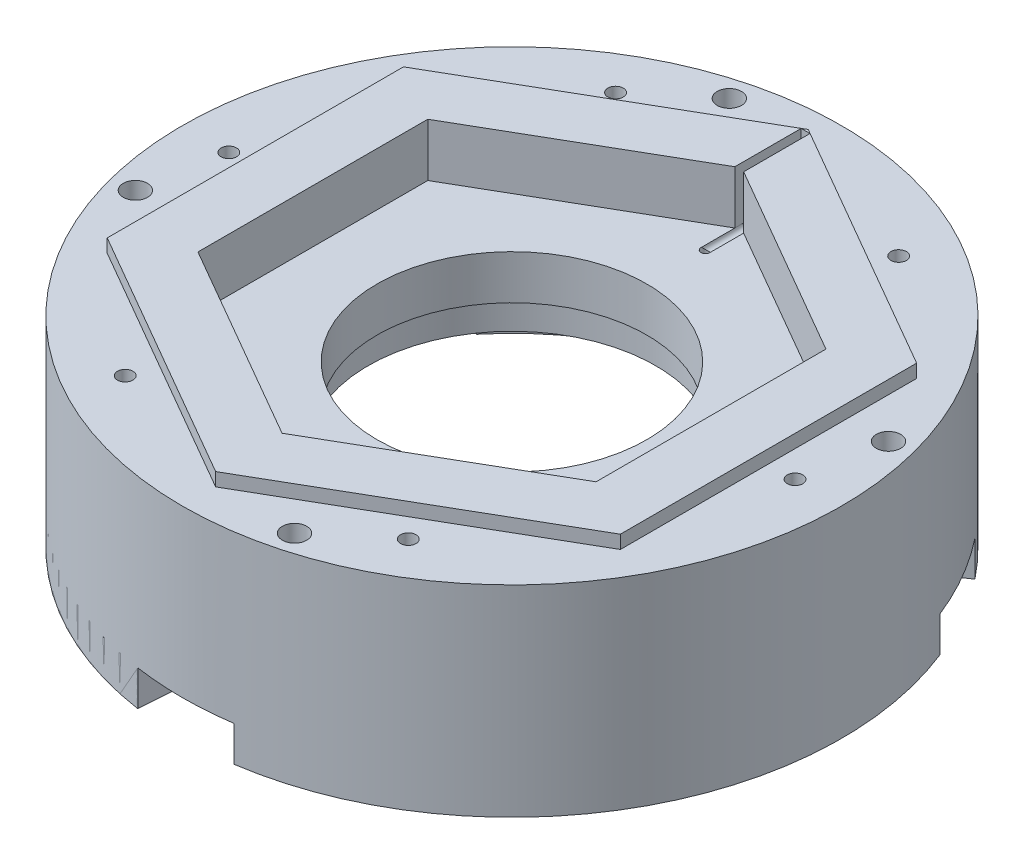
from build123d import *
from build123d.topology import SkipClean

# Parameters (mm, degrees)
CROQUIS1_R                 = 38.85
CROQUIS1_R_2               = 32.5
SALIENTE_EXTRUIR1_DEPTH    = 17
CROQUIS3_R                 = 59.5
CROQUIS3_R_2               = 38.85
SALIENTE_EXTRUIR2_DEPTH    = 5
CROQUIS4_R                 = 74.5
CROQUIS4_R_2               = 59.5
SALIENTE_EXTRUIR3_DEPTH    = 28.5
SALIENTE_EXTRUIR4_START    = 12
CROQUIS5_R                 = 74.5
SALIENTE_EXTRUIR4_DEPTH    = 12
CROQUIS6_R                 = 32.5
CROQUIS6_R_2               = 30.5
SALIENTE_EXTRUIR5_DEPTH    = 10
SALIENTE_EXTRUIR6_START    = 1
CROQUIS9_R                 = 40.85
CROQUIS9_R_2               = 38.85
SALIENTE_EXTRUIR6_DEPTH    = 1
CORTAR_EXTRUIR1_DEPTH      = 110.277170534
CORTAR_EXTRUIR1_DEPTH_BACK = 110.277170534
SALIENTE_EXTRUIR7_DEPTH    = 8
CROQUIS12_R                = 1
CROQUIS14_R                = 1.75
CORTAR_EXTRUIR2_DEPTH      = 5
CROQUIS15_R                = 74.5
CROQUIS15_R_2              = 32
CORTAR_EXTRUIR4_DEPTH      = 3
CROQUIS16_R                = 1.75
CORTAR_EXTRUIR5_DEPTH      = 5
CROQUIS18_R                = 1.75
CORTAR_EXTRUIR6_DEPTH      = 5
CORTAR_EXTRUIR7_START      = -12
CORTAR_EXTRUIR7_DEPTH      = 12
CROQUIS21_R                = 1.5
CORTAR_EXTRUIR8_DEPTH      = 5
CROQUIS22_R                = 2.75
CORTAR_EXTRUIR9_DEPTH      = 116.985990533
SKETCH1_R                  = 1.5
CUT_EXTRUDE1_DEPTH         = 5


# Read off the part's stored shape, not the designer's step: Cortar-Extruir7
with BuildPart() as part:
    # Croquis1 → Saliente-Extruir1 (new body)
    with BuildSketch(Plane(origin=(0, 0, 0), x_dir=(1, 0, 0), z_dir=(0, 1, 0))):
        with Locations(Location((0, 0, 0), (0, 0, 270))):
            Circle(CROQUIS1_R)
        with Locations(Location((0, 0, 0), (0, 0, 270))):
            Circle(CROQUIS1_R_2, mode=Mode.SUBTRACT)
    extrude(amount=SALIENTE_EXTRUIR1_DEPTH)



with BuildPart() as body_2:
    # Croquis3 → Saliente-Extruir2 (new body)
    with BuildSketch(Plane(origin=(0, 17, 0), x_dir=(1, 0, 0), z_dir=(0, 1, 0))):
        with Locations(Location((0, 0, 0), (0, 0, 270))):
            Circle(CROQUIS3_R)
        with Locations(Location((0, 0, 0), (0, 0, 270))):
            Circle(CROQUIS3_R_2, mode=Mode.SUBTRACT)
    extrude(amount=-SALIENTE_EXTRUIR2_DEPTH)


with BuildPart() as part_1:
    add(part.part)

    add(body_2.part)  # Saliente-Extruir3 merges body 2
    # Croquis4 → Saliente-Extruir3 (add)
    with BuildSketch(Plane(origin=(0, 17, 0), x_dir=(1, 0, 0), z_dir=(0, 1, 0))):
        with Locations(Location((0, 0, 0), (0, 0, 270))):
            Circle(CROQUIS4_R)
        with Locations(Location((0, 0, 0), (0, 0, 270))):
            Circle(CROQUIS4_R_2, mode=Mode.SUBTRACT)
    extrude(amount=-SALIENTE_EXTRUIR3_DEPTH)

    # Croquis5 → Saliente-Extruir4 (add)
    with BuildSketch(Plane(origin=(0, 17, 0), x_dir=(1, 0, 0), z_dir=(0, 1, 0)).offset(SALIENTE_EXTRUIR4_START)):
        with Locations(Location((0, 0, 0), (0, 0, 270))):
            Circle(CROQUIS5_R)
        Polygon((0, 51.961524227), (-45, 25.980762114), (-45, -25.980762114), (0, -51.961524227), (45, -25.980762114), (45, 25.980762114), align=None, mode=Mode.SUBTRACT)
    extrude(amount=-SALIENTE_EXTRUIR4_DEPTH)


with BuildPart() as body_2_2:
    # Croquis6 → Saliente-Extruir5 (new body)
    with BuildSketch(Plane(origin=(0, 17, 0), x_dir=(1, 0, 0), z_dir=(0, 1, 0))):
        with Locations(Location((0, 0, 0), (0, 0, 270))):
            Circle(CROQUIS6_R)
        with Locations(Location((0, 0, 0), (0, 0, 270))):
            Circle(CROQUIS6_R_2, mode=Mode.SUBTRACT)
    extrude(amount=-SALIENTE_EXTRUIR5_DEPTH)


    add(part_1.part)  # Saliente-Extruir6 merges part
    # Croquis9 → Saliente-Extruir6 (add)
    with BuildSketch(Plane(origin=(0, 12, 0), x_dir=(-1, 0, 0), z_dir=(0, -1, 0)).offset(SALIENTE_EXTRUIR6_START)):
        with Locations(Location((0, 0, 0), (0, 0, 270))):
            Circle(CROQUIS9_R)
        with Locations(Location((0, 0, 0), (0, 0, 90))):
            Circle(CROQUIS9_R_2, mode=Mode.SUBTRACT)
    extrude(amount=-SALIENTE_EXTRUIR6_DEPTH)

    # Croquis10 → Cortar-Extruir1 (cut, two sides: drawn at the far end of the back side and taken through both)
    with BuildSketch(Plane.XZ.offset(-CORTAR_EXTRUIR1_DEPTH_BACK)):
        with BuildLine():
            Line((0, 0), (0, 93.15188238))
            ThreePointArc((0, 93.15188238), (-93.15188238, 0), (0, -93.15188238))
            Line((0, -93.15188238), (0, 0))
        make_face()
    extrude(amount=CORTAR_EXTRUIR1_DEPTH + CORTAR_EXTRUIR1_DEPTH_BACK, mode=Mode.SUBTRACT)

    # Croquis17 → Saliente-Extruir7 (add)
    with SkipClean():  # the faces are left unmerged after this step: merging them gives an invalid solid
        with BuildSketch(Plane(origin=(0, -11.5, 0), x_dir=(-1, 0, 0), z_dir=(0, -1, 0))):
            with BuildLine():
                Line((55.737099059, 20.823683355), (69.265641396, 27.432114792))
                ThreePointArc((69.265641396, 27.432114792), (64.518892582, -37.25), (10.875912409, -73.701862455))
                Line((10.875912409, -73.701862455), (9.834710744, -58.681585396))
                ThreePointArc((9.834710744, -58.681585396), (51.528511525, -29.75), (55.737099059, 20.823683355))
            make_face()
            with BuildLine():
                Line((45.902388315, 37.857902041), (58.389728988, 46.269747663))
                ThreePointArc((58.389728988, 46.269747663), (0, 74.5), (-58.389728988, 46.269747663))
                Line((-58.389728988, 46.269747663), (-45.902388315, 37.857902041))
                ThreePointArc((-45.902388315, 37.857902041), (0, 59.5), (45.902388315, 37.857902041))
            make_face()
            with BuildLine():
                Line((-55.737099059, 20.823683355), (-69.257696989, 27.452165812))
                ThreePointArc((-69.257696989, 27.452165812), (-64.524283781, -37.240660609), (-10.875912409, -73.701862455))
                Line((-10.875912409, -73.701862455), (-9.834710744, -58.681585396))
                ThreePointArc((-9.834710744, -58.681585396), (-51.528511525, -29.75), (-55.737099059, 20.823683355))
            make_face()
        extrude(amount=SALIENTE_EXTRUIR7_DEPTH)


with BuildPart() as saliente_extruir7_piece_1:
    # of the separate pieces the step leaves, piece 1, a body of its own (saliente_extruir7_pieces)
    add(body_2_2.part.solids().sort_by_distance((0, 17, 51.961524227))[0])

    # Cortar-Barrer1: sweep along a path in Croquis11
    with SkipClean():  # the faces are left unmerged after this step: merging them gives an invalid solid
        with BuildLine(Plane.ZY) as cortar_barrer1_path:
            Line((-43.85, 12), (-43.85, 17))
            Line((-43.85, 17), (-71.5, 17))
            Line((-71.5, 17), (-71.5, -19.5))
        # Croquis12 → Cortar-Barrer1 (sweep, cut)
        with BuildSketch(Plane(origin=(0, 12, 0), x_dir=(-1, 0, 0), z_dir=(0, -1, 0))):
            with Locations((0, 43.74979684)):
                Circle(CROQUIS12_R)
        sweep(path=cortar_barrer1_path.line, transition=Transition.RIGHT, mode=Mode.SUBTRACT)

    # Simetría2: Saliente-Extruir7 piece 1 across plane


with BuildPart() as saliente_extruir7_piece_2:
    # of the separate pieces the step leaves, piece 2, a body of its own (saliente_extruir7_pieces)
    add(body_2_2.part.solids().sort_by_distance((-55.737099059, -11.5, -20.823683355))[0])

    # Croquis21 → Cortar-Extruir8 (cut)
    with BuildSketch(Plane.XZ.offset(19.5)):
        with Locations(Location((-34.5, 59.755752861, 0), (0, 0, 270))):
            Circle(CROQUIS21_R)
    extrude(amount=-CORTAR_EXTRUIR8_DEPTH, mode=Mode.SUBTRACT)


with BuildPart() as saliente_extruir7_piece_1_1:
    with SkipClean():  # the faces are left unmerged after this step: merging them gives an invalid solid
        add(saliente_extruir7_piece_1.part)
        add(saliente_extruir7_piece_1.part.mirror(Plane(origin=(0, 29, 0), x_dir=(0, 0, 1), z_dir=(1, 0, 0))))

    # Croquis14 → Cortar-Extruir2 (cut)
    with SkipClean():  # the faces are left unmerged after this step: merging them gives an invalid solid
        with BuildSketch(Plane.XZ.offset(11.5)):
            with Locations(Location((0, 69, 0), (0, 0, 270))):
                Circle(CROQUIS14_R)
            with Locations(Location((59.755752861, -34.5, 0), (0, 0, 270))):
                Circle(CROQUIS14_R)
            with Locations(Location((-59.755752861, -34.5, 0), (0, 0, 270))):
                Circle(CROQUIS14_R)
        extrude(amount=-CORTAR_EXTRUIR2_DEPTH, mode=Mode.SUBTRACT)

    # Croquis15 → Cortar-Extruir4 (cut)
    # profile 1 of 2: a face of its own
    with SkipClean():  # the faces are left unmerged after this step: merging them gives an invalid solid
        with BuildSketch(Plane(origin=(0, 29, 0), x_dir=(1, 0, 0), z_dir=(0, 1, 0))):
            with Locations(Location((0, 0, 0), (0, 0, 270))):
                Circle(CROQUIS15_R)
            Polygon((-58, -33.486315613), (0, -66.972631226), (58, -33.486315613), (58, 33.486315613), (0, 66.972631226), (-58, 33.486315613), align=None, mode=Mode.SUBTRACT)
        # profile 2 of 2: a face of its own
        with BuildSketch(Plane(origin=(0, 29, 0), x_dir=(1, 0, 0), z_dir=(0, 1, 0))):
            Circle(CROQUIS15_R_2)
        extrude(amount=-CORTAR_EXTRUIR4_DEPTH, mode=Mode.SUBTRACT)

    # Croquis16 → Cortar-Extruir5 (cut)
    with SkipClean():  # the faces are left unmerged after this step: merging them gives an invalid solid
        with BuildSketch(Plane(origin=(0, 26, 0), x_dir=(1, 0, 0), z_dir=(0, 1, 0))):
            with Locations(Location((-64, 0, 0), (0, 0, 270))):
                Circle(CROQUIS16_R)
            with Locations(Location((-32, 55.425625842, 0), (0, 0, 270))):
                Circle(CROQUIS16_R)
            with Locations(Location((32, 55.425625842, 0), (0, 0, 270))):
                Circle(CROQUIS16_R)
            with Locations(Location((64, 0, 0), (0, 0, 270))):
                Circle(CROQUIS16_R)
            with Locations(Location((32, -55.425625842, 0), (0, 0, 270))):
                Circle(CROQUIS16_R)
            with Locations(Location((-32, -55.425625842, 0), (0, 0, 270))):
                Circle(CROQUIS16_R)
        extrude(amount=-CORTAR_EXTRUIR5_DEPTH, mode=Mode.SUBTRACT)

    # Croquis18 → Cortar-Extruir6 (cut)
    with SkipClean():  # the faces are left unmerged after this step: merging them gives an invalid solid
        with BuildSketch(Plane(origin=(0, -19.5, 0), x_dir=(-1, 0, 0), z_dir=(0, -1, 0))):
            with Locations(Location((34.5, -59.755752861, 0), (0, 0, 90))):
                Circle(CROQUIS18_R)
            with Locations(Location((-69, 0, 0), (0, 0, 90))):
                Circle(CROQUIS18_R)
            with Locations(Location((34.5, 59.755752861, 0), (0, 0, 90))):
                Circle(CROQUIS18_R)
        extrude(amount=-CORTAR_EXTRUIR6_DEPTH, mode=Mode.SUBTRACT)

    # Cortar-Extruir7 outline → Cortar-Extruir7 (cut)
    with SkipClean():  # the faces are left unmerged after this step: merging them gives an invalid solid
        with BuildSketch(Plane(origin=(0, 29, 0), x_dir=(1, 0, 0), z_dir=(0, 1, 0)).offset(CORTAR_EXTRUIR7_START)):
            Polygon((0.994966998, 51.387079763), (0.994966998, 66.384173958), (-1, 66.384173958), (-1, 51.384173958), (0, 51.961524227), align=None)
        extrude(amount=CORTAR_EXTRUIR7_DEPTH, mode=Mode.SUBTRACT)


with BuildPart() as cortar_extruir9_tool:
    # Croquis22 → Cortar-Extruir9 (new, through all)
    with SkipClean():  # the faces are left unmerged after this step: merging them gives an invalid solid
        with BuildSketch(Plane.XZ.offset(19.5)):
            with Locations(Location((17.987923635, 67.131844927, 0), (0, 0, 270))):
                Circle(CROQUIS22_R)
            with Locations(Location((67.131844927, -17.987923635, 0), (0, 0, 270))):
                Circle(CROQUIS22_R)
            with Locations(Location((-17.987923635, -67.131844927, 0), (0, 0, 270))):
                Circle(CROQUIS22_R)
            with Locations(Location((-67.131844927, 17.987923635, 0), (0, 0, 270))):
                Circle(CROQUIS22_R)
        extrude(amount=-CORTAR_EXTRUIR9_DEPTH)


with BuildPart() as saliente_extruir7_piece_1_2:
    with SkipClean():  # the faces are left unmerged after this step: merging them gives an invalid solid
        add(saliente_extruir7_piece_1_1.part)

        # Cortar-Extruir9: cut by cortar_extruir9_tool
        add(cortar_extruir9_tool.part, mode=Mode.SUBTRACT)


with BuildPart() as saliente_extruir7_piece_2_1:
    with SkipClean():  # the faces are left unmerged after this step: merging them gives an invalid solid
        add(saliente_extruir7_piece_2.part)

        # Cortar-Extruir9: cut by cortar_extruir9_tool
        add(cortar_extruir9_tool.part, mode=Mode.SUBTRACT)


with BuildPart() as cut_extrude1_tool:
    # Sketch1 → Cut-Extrude1 (new body)
    with SkipClean():  # the faces are left unmerged after this step: merging them gives an invalid solid
        with BuildSketch(Plane(origin=(0, -19.5, 0), x_dir=(-1, 0, 0), z_dir=(0, -1, 0))):
            with Locations(Location((-28.102236634, 55.069001454, 0), (0, 0, 90))):
                Circle(SKETCH1_R)
            with Locations(Location((28.102236634, -55.069001454, 0), (0, 0, 90))):
                Circle(SKETCH1_R)
        extrude(amount=-CUT_EXTRUDE1_DEPTH)


with BuildPart() as saliente_extruir7_piece_1_3:
    with SkipClean():  # the faces are left unmerged after this step: merging them gives an invalid solid
        add(saliente_extruir7_piece_1_2.part)

        # Cut-Extrude1: cut by cut_extrude1_tool
        add(cut_extrude1_tool.part, mode=Mode.SUBTRACT)


with BuildPart() as saliente_extruir7_piece_2_2:
    with SkipClean():  # the faces are left unmerged after this step: merging them gives an invalid solid
        add(saliente_extruir7_piece_2_1.part)

        # Cut-Extrude1: cut by cut_extrude1_tool
        add(cut_extrude1_tool.part, mode=Mode.SUBTRACT)


solid = Compound([saliente_extruir7_piece_1_3.part, saliente_extruir7_piece_2_2.part])
